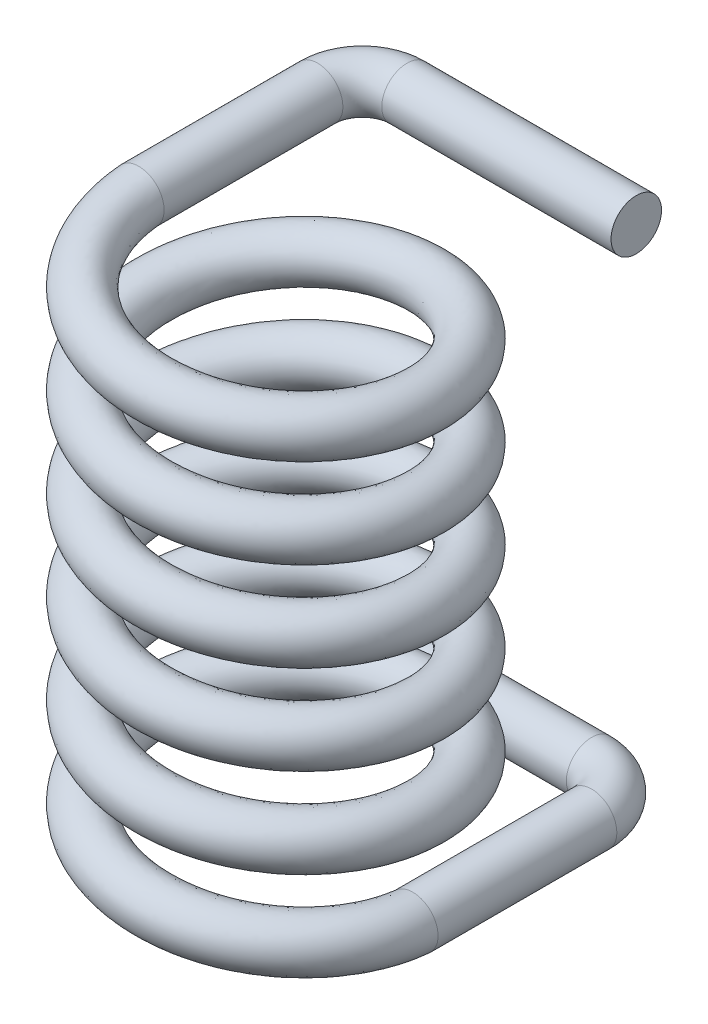
from build123d import *

# Parameters (mm, degrees)
SWEEP1_PITCH       = 4
SWEEP1_HEIGHT      = 22
SWEEP1_RADIUS      = 6.13
SWEEP1_START_ANGLE = 90
SKETCH1_R          = 1.13
SKETCH1_3_R        = 1.13
SWEEP3_OUTLINE_R   = 1.13
SWEEP3_ANGLE       = 90
SWEEP3_START       = -8.0000001
SWEEP3_2_OUTLINE_R = 1.13
SWEEP3_2_DEPTH     = 8.0000001
SWEEP3_START_2     = -4.1300001
SWEEP3_3_OUTLINE_R = 1.13
SWEEP3_3_DEPTH     = 10.2600001


with BuildPart() as part:
    # Sweep1: sweep along a helix
    with BuildLine() as sweep1_path:
        add(Helix(SWEEP1_PITCH, SWEEP1_HEIGHT, SWEEP1_RADIUS, center=(0, 0, 0), direction=(0, 1, 0), lefthand=True, mode=Mode.PRIVATE).rotate(Axis((0, 0, 0), (0, 1, 0)), SWEEP1_START_ANGLE))
    # Sketch1 → Sweep1 (sweep)
    with BuildSketch(Plane.XY):
        with Locations((6.13, 0)):
            Circle(SKETCH1_R)
    sweep(path=sweep1_path.line, is_frenet=True)

    # Sweep2: sweep along a path in Sketch3
    with BuildLine(Plane(origin=(0, 0, 0), x_dir=(1, 0, 0), z_dir=(0, 1, 0))) as sweep2_path:
        Line((6.13, 0), (6.13, 8))
        ThreePointArc((6.13, 8), (5.544213562, 9.414213562), (4.13, 10))
        Line((4.13, 10), (-6.13, 10))
    # Sketch1<3> → Sweep2 (sweep)
    with BuildSketch(Plane.XY):
        with Locations((6.13, 0)):
            Circle(SKETCH1_3_R)
    sweep(path=sweep2_path.line)



with BuildPart() as body_2:
    # Sweep3: read off the stored shape, not the designer's step
    # Sweep3 outline → Sweep3 (revolve)
    with BuildSketch(Plane(origin=(-4.13, 0, -8), x_dir=(0, 0, -1), z_dir=(1, 0, 0))):
        with Locations((2, 22)):
            Circle(SWEEP3_OUTLINE_R)
    revolve(axis=Axis((-4.13, 0, -8), (0, 1, 0)), revolution_arc=SWEEP3_ANGLE)


with BuildPart() as part_1:
    add(part.part)

    add(body_2.part)  # Sweep3 2 merges body 2
    # Sweep3 2 outline → Sweep3 2 (add)
    with BuildSketch(Plane.XY.offset(SWEEP3_START)):
        with Locations((-6.13, 22)):
            Circle(SWEEP3_2_OUTLINE_R)
    extrude(amount=SWEEP3_2_DEPTH)

    # Sweep3 3 outline → Sweep3 3 (add)
    with BuildSketch(Plane.YZ.offset(SWEEP3_START_2)):
        with Locations((22, -10)):
            Circle(SWEEP3_3_OUTLINE_R)
    extrude(amount=SWEEP3_3_DEPTH)


solid = part_1.part
